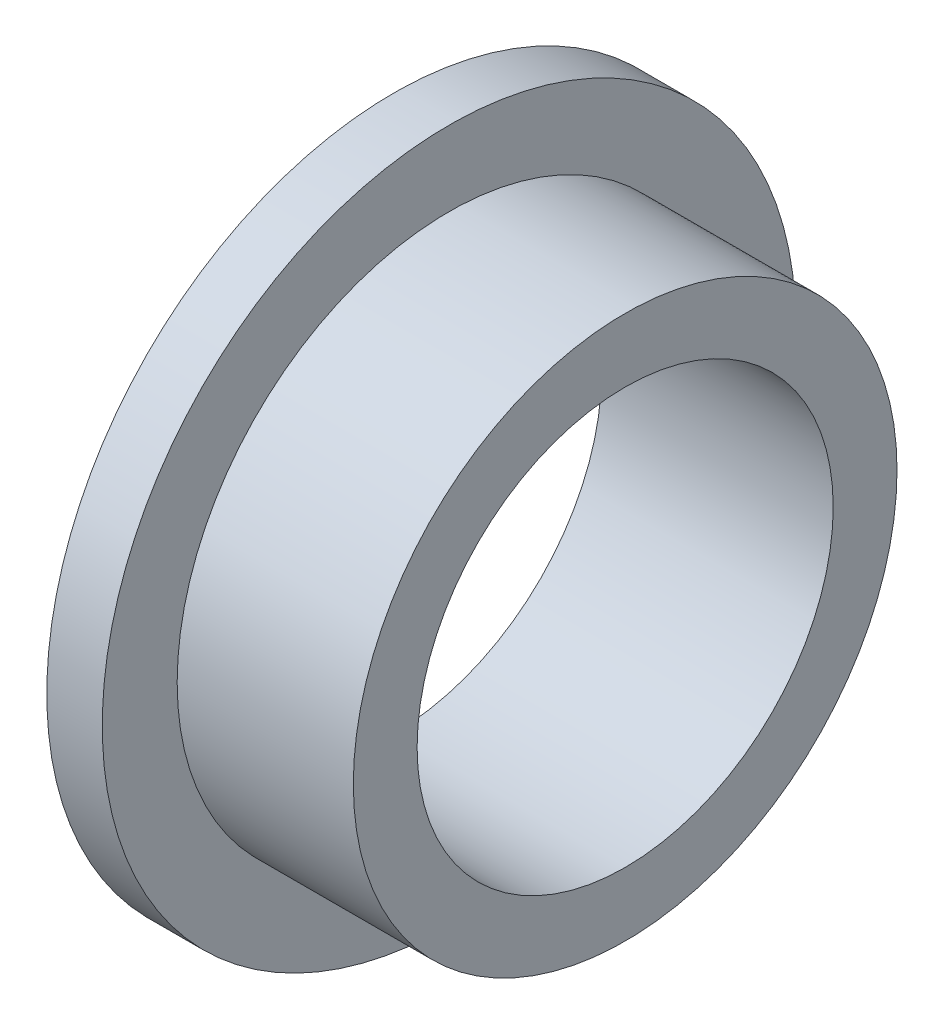
from build123d import *

# Parameters (mm, degrees)
SKETCH1_R           = 12.5
SKETCH1_R_2         = 7.5
BOSS_EXTRUDE1_DEPTH = 2
SKETCH2_R           = 9.8
SKETCH2_R_2         = 7.5
BOSS_EXTRUDE2_DEPTH = 6.35


with BuildPart() as part:
    # Sketch1 → Boss-Extrude1 (new body)
    with BuildSketch(Plane(origin=(0, 0, 0), x_dir=(0, 0, -1), z_dir=(1, 0, 0))):
        Circle(SKETCH1_R)
        Circle(SKETCH1_R_2, mode=Mode.SUBTRACT)
    extrude(amount=BOSS_EXTRUDE1_DEPTH)

    # Sketch2 → Boss-Extrude2 (add)
    with BuildSketch(Plane(origin=(2, 0, 0), x_dir=(0, 0, -1), z_dir=(1, 0, 0))):
        Circle(SKETCH2_R)
        Circle(SKETCH2_R_2, mode=Mode.SUBTRACT)
    extrude(amount=BOSS_EXTRUDE2_DEPTH)


solid = part.part
